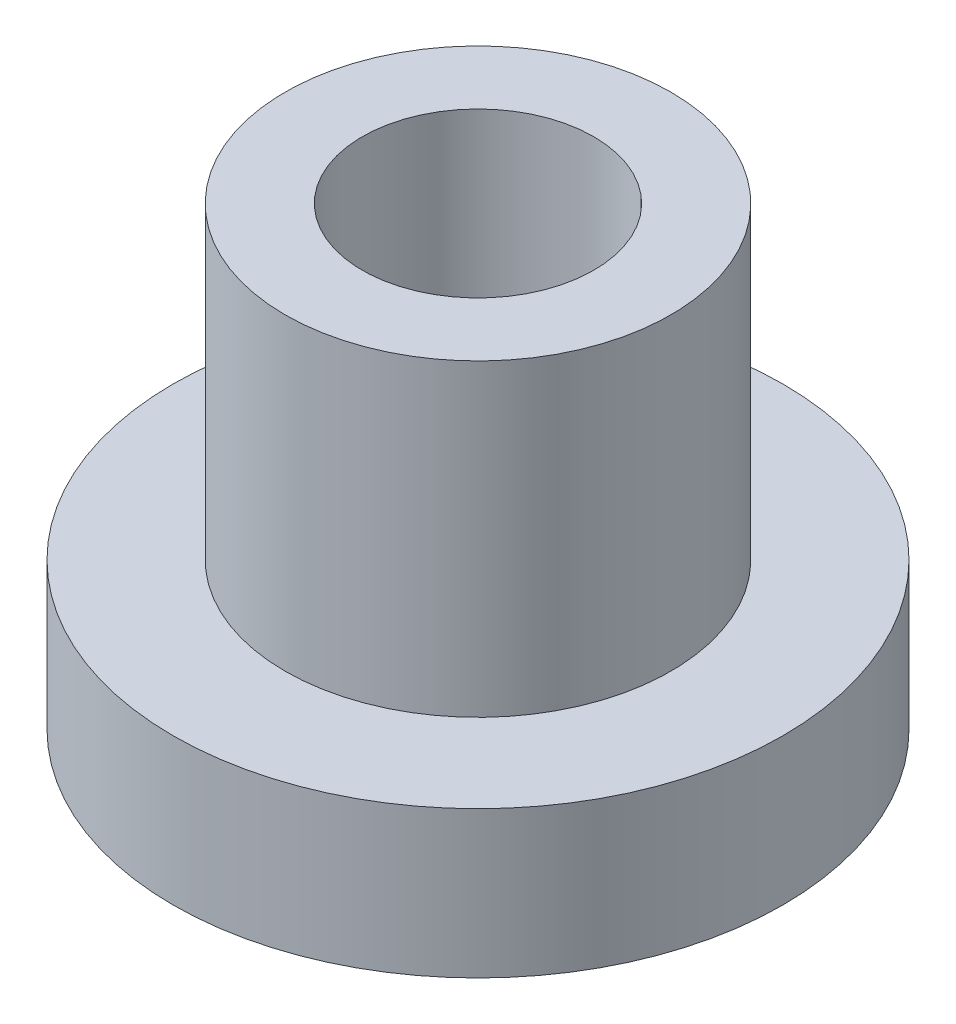
from build123d import *

# Parameters (mm, degrees)
SKETCH1_R           = 3.95
SKETCH1_R_2         = 1.5
BOSS_EXTRUDE1_DEPTH = 1.9
SKETCH2_R           = 2.5
SKETCH2_R_2         = 1.5
BOSS_EXTRUDE2_DEPTH = 4


with BuildPart() as part:
    # Sketch1 → Boss-Extrude1 (new body)
    with BuildSketch(Plane(origin=(0, 0, 0), x_dir=(1, 0, 0), z_dir=(0, 1, 0))):
        Circle(SKETCH1_R)
        Circle(SKETCH1_R_2, mode=Mode.SUBTRACT)
    extrude(amount=BOSS_EXTRUDE1_DEPTH)

    # Sketch2 → Boss-Extrude2 (add)
    with BuildSketch(Plane(origin=(0, 1.9, 0), x_dir=(1, 0, 0), z_dir=(0, 1, 0))):
        Circle(SKETCH2_R)
        Circle(SKETCH2_R_2, mode=Mode.SUBTRACT)
    extrude(amount=BOSS_EXTRUDE2_DEPTH)


solid = part.part
